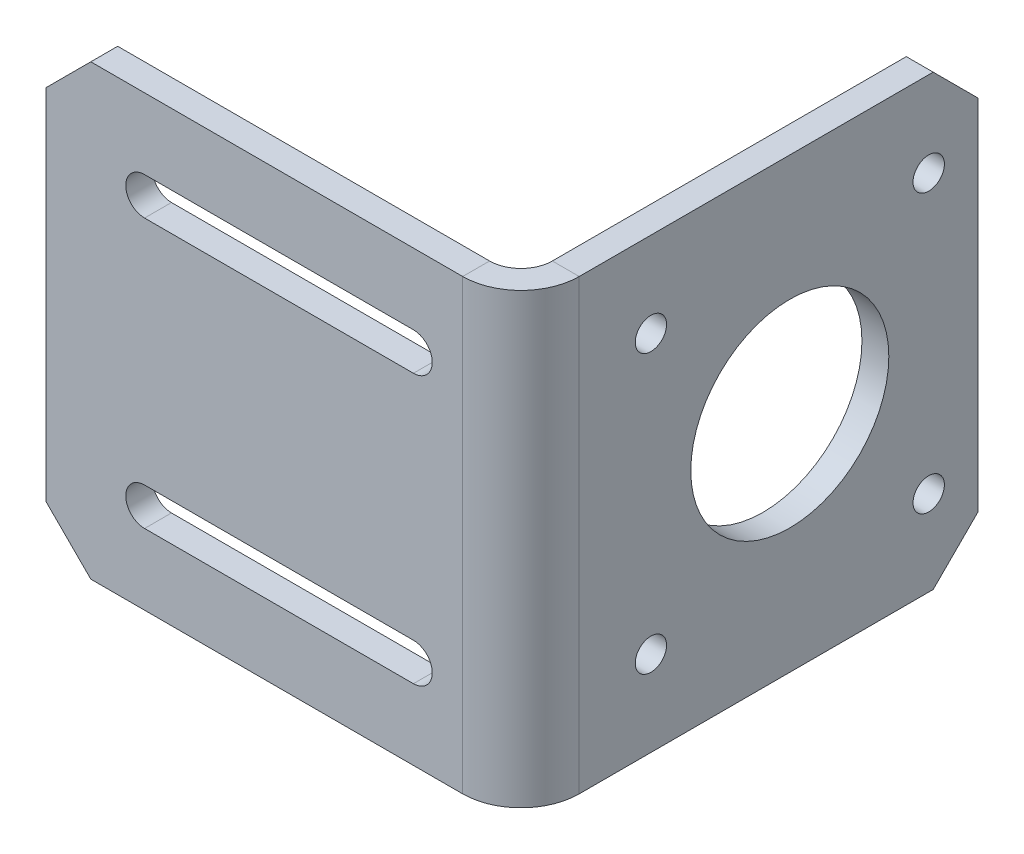
from build123d import *

# Parameters (mm, degrees)
BASE_FLANGE1_DEPTH = 25
CHAMFER1_SIZE      = 5
SKETCH7_R          = 11.05
SKETCH7_R_2        = 1.75
CUT_EXTRUDE1_DEPTH = 78.685262438
CUT_EXTRUDE2_DEPTH = 78.685262438


# Sheet-metal steps are written as plain solids
with BuildPart() as part:
    # Sketch2 → Base-Flange1 (new, symmetric)
    with BuildSketch(Plane(origin=(0, 0, 0), x_dir=(1, 0, 0), z_dir=(0, 1, 0))):
        with BuildLine():
            Line((0, 51), (0, 6.5))
            ThreePointArc((0, 6.5), (-1.903805922, 1.903805922), (-6.5, 0))
            Line((-6.5, 0), (-53, 0))
            Line((-53, 0), (-53, 3))
            Line((-53, 3), (-6.5, 3))
            ThreePointArc((-6.5, 3), (-4.025126266, 4.025126266), (-3, 6.5))
            Line((-3, 6.5), (-3, 51))
            Line((-3, 51), (0, 51))
        make_face()
    extrude(amount=BASE_FLANGE1_DEPTH, both=True)

    # Chamfer1
    chamfer1_edges = [part.edges().sort_by_distance(p)[0] for p in [
        (-1.5, 25, -51),
        (-53, 25, -1.5),
        (-1.5, -25, -51),
        (-53, -25, -1.5),
    ]]
    chamfer(chamfer1_edges, length=CHAMFER1_SIZE)

    # Sketch7 → Cut-Extrude1 (cut, through all)
    with BuildSketch(Plane(origin=(0, 0, 0), x_dir=(0, 0, -1), z_dir=(1, 0, 0))):
        with Locations((30, 0)):
            Circle(SKETCH7_R)
        with Locations((45.5, 15.5)):
            Circle(SKETCH7_R_2)
        with Locations((14.5, 15.5)):
            Circle(SKETCH7_R_2)
        with Locations((14.5, -15.5)):
            Circle(SKETCH7_R_2)
        with Locations((45.5, -15.5)):
            Circle(SKETCH7_R_2)
    extrude(amount=-CUT_EXTRUDE1_DEPTH, mode=Mode.SUBTRACT)

    # Sketch8 → Cut-Extrude2 (cut, through all)
    with BuildSketch(Plane.XY):
        with BuildLine():
            Line((-42, 17.1), (-12, 17.1))
            ThreePointArc((-12, 17.1), (-9.9, 15), (-12, 12.9))
            Line((-12, 12.9), (-42, 12.9))
            ThreePointArc((-42, 12.9), (-44.1, 15), (-42, 17.1))
        make_face()
        with BuildLine():
            Line((-42, -17.1), (-12, -17.1))
            ThreePointArc((-12, -17.1), (-9.9, -15), (-12, -12.9))
            Line((-12, -12.9), (-42, -12.9))
            ThreePointArc((-42, -12.9), (-44.1, -15), (-42, -17.1))
        make_face()
    extrude(amount=-CUT_EXTRUDE2_DEPTH, mode=Mode.SUBTRACT)


solid = part.part
